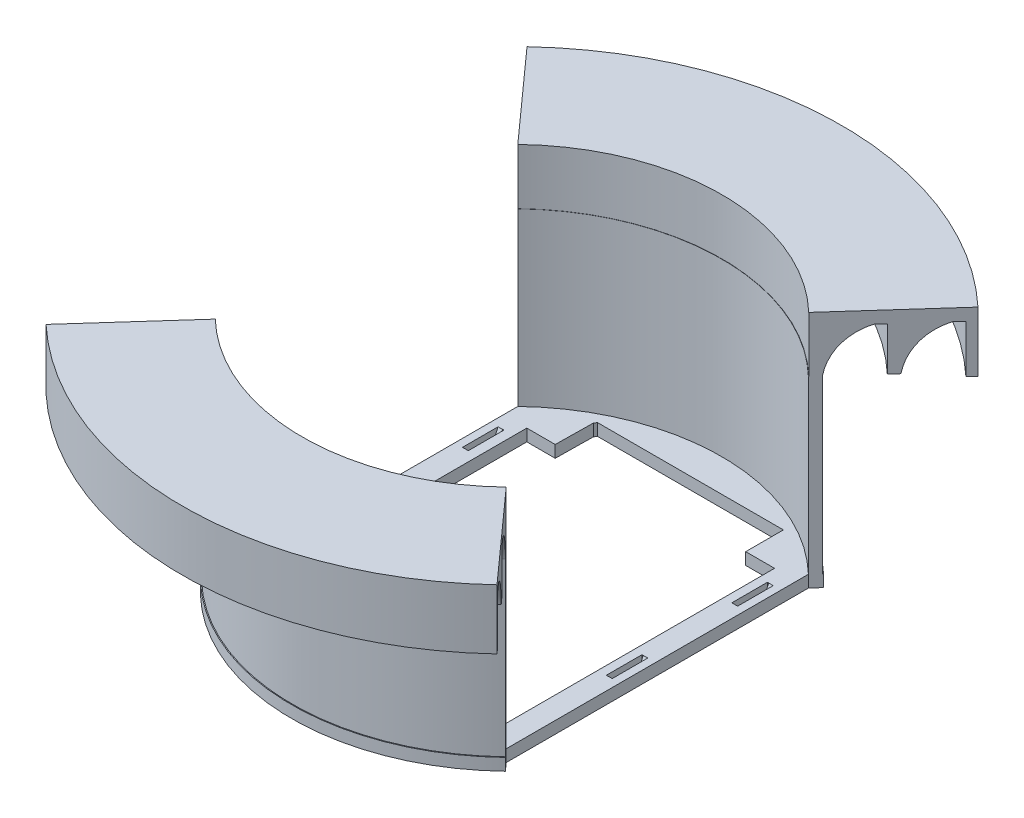
from build123d import *

# Parameters (mm, degrees)
SKETCH1_R                = 51.5
BOSS_EXTRUDE1_DEPTH      = 2.8
SKETCH2_R                = 51.302702975
SKETCH2_R_2              = 49
BOSS_EXTRUDE2_DEPTH      = 40
CUT_EXTRUDE1_DEPTH       = 2.8
SNAP_START               = -32.152970268
SNAP_GROOVE2_DEPTH       = 1.05
SNAP_START_2             = -33.102970268
SNAP_GROOVE2_2_DEPTH     = 0.95
CUT_EXTRUDE9_DEPTH       = 123.425444719
MIRROR10_START           = -32.152970268
MIRROR10_COPY_1_DEPTH    = 1.05
MIRROR10_START_2         = -33.102970268
MIRROR10_COPY_2_DEPTH    = 0.95
MIRROR10_COPY_3_DEPTH    = 0.95
SKETCH23_W               = 0.31
SKETCH23_H               = 8.321250797
CUT_EXTRUDE18_DEPTH      = 10
MIRROR12_COPY_1_SKETCH_W = 0.31
MIRROR12_COPY_1_SKETCH_H = 8.321250797
MIRROR12_COPY_1_DEPTH    = 10


# Read off the part's stored shape, not the designer's step: Snap Groove2
with BuildPart() as part:
    # Sketch1 → Boss-Extrude1 (new body)
    with BuildSketch(Plane(origin=(0, 0, 0), x_dir=(1, 0, 0), z_dir=(0, 1, 0))):
        with Locations(Location((0, 0, 0), (0, 0, 270))):
            Circle(SKETCH1_R)
    extrude(amount=BOSS_EXTRUDE1_DEPTH)

    # Sketch2 → Boss-Extrude2 (add)
    with BuildSketch(Plane(origin=(0, 2.8, 0), x_dir=(1, 0, 0), z_dir=(0, 1, 0))):
        with Locations(Location((0, 0, 0), (0, 0, 270))):
            Circle(SKETCH2_R)
        with Locations(Location((0, 0, 0), (0, 0, 270))):
            Circle(SKETCH2_R_2, mode=Mode.SUBTRACT)
    extrude(amount=BOSS_EXTRUDE2_DEPTH)

    # Sketch3 → Cut-Extrude1 (cut)
    with BuildSketch(Plane(origin=(0, 2.8, 0), x_dir=(1, 0, 0), z_dir=(0, 1, 0))):
        Polygon((28.803377941, 30.903803584), (28.803377941, -35.91647658), (22.504161148, -35.91647658), (22.611913195, -42.365053075), (21.509867104, -43.633319461), (18.751547007, -44.925112233), (17.307649543, -45.070983147), (-17.226935769, -45.070983147), (-18.600923478, -44.925112233), (-21.77353452, -43.416317025), (-21.77353452, -43.046957831), (-21.893563057, -35.863677115), (-28.534712584, -35.863677115), (-28.534712584, 31.993942871), (-21.893563057, 31.993942871), (-21.77353452, 40.794290055), (-21.388795882, 41.368785458), (22.021637567, 41.368785458), (22.058242529, 41.352489898), (22.058242529, 32.561962301), (28.803377941, 32.561962301), align=None)
    extrude(amount=-CUT_EXTRUDE1_DEPTH, mode=Mode.SUBTRACT)

    # Sketch5 → Revolve1 (revolve)
    with BuildSketch(Plane(origin=(0, 0, 0), x_dir=(0, 0, -1), z_dir=(1, 0, 0)), mode=Mode.PRIVATE) as revolve1_sk:
        with BuildLine():
            Line((-51.302702975, 42.8), (-49.053064555, 42.8))
            Line((-49.053064555, 42.8), (-49.053064555, 55.8))
            Line((-49.053064555, 55.8), (-60.053064555, 55.8))
            Line((-60.053064555, 55.8), (-60.053064555, 53.073629834))
            ThreePointArc((-60.053064555, 53.073629834), (-54.22806986, 49.171665315), (-51.302702975, 42.8))
        make_face()
        Polygon((-60.053064555, 53.073629834), (-60.053064555, 55.8), (-62.053064555, 55.8), (-62.053064555, 52.983272883), (-60.053064555, 52.983272883), align=None)
        with BuildLine():
            Line((-62.053064555, 52.983272883), (-62.053064555, 55.8))
            Line((-62.053064555, 55.8), (-73.053064555, 55.8))
            Line((-73.053064555, 55.8), (-73.053064555, 53.073629834))
            ThreePointArc((-73.053064555, 53.073629834), (-67.22806986, 49.171665315), (-64.302702975, 42.8))
            Line((-64.302702975, 42.8), (-62.053064555, 42.8))
            Line((-62.053064555, 42.8), (-62.053064555, 52.983272883))
        make_face()
        Polygon((-73.053064555, 53.073629834), (-73.053064555, 55.8), (-77.053064555, 55.8), (-77.053064555, 41.8), (-75.053064555, 41.8), (-75.053064555, 52.983272883), (-73.053064555, 52.983272883), align=None)
    revolve(revolve1_sk.sketch.rotate(Axis((0, 42.8, 0), (0, 1, 0)), 180), axis=Axis((0, 42.8, 0), (0, 1, 0)))

    # Snap Groove2 outline → Snap Groove2 (cut)
    with BuildSketch(Plane.YZ.offset(SNAP_START)):
        Polygon((0, 7.425343804), (0, 1.722535804), (2.8, 0.416874361), (2.8, 8.731005247), align=None)
    snap_groove2 = extrude(amount=SNAP_GROOVE2_DEPTH, mode=Mode.SUBTRACT)

    # Snap Groove2 2 outline → Snap Groove2 2 (cut)
    with BuildSketch(Plane.YZ.offset(SNAP_START_2)):
        Polygon((0, 7.425343804), (0, 1.722535804), (0.54641169, 1.467739849), (0.54641169, 7.68013976), align=None)
    snap_groove2_2 = extrude(amount=SNAP_GROOVE2_2_DEPTH, mode=Mode.SUBTRACT)

    # Sketch13 → Cut-Extrude9 (cut, symmetric)
    with BuildSketch(Plane(origin=(0, 55.8, 0), x_dir=(1, 0, 0), z_dir=(0, 1, 0))):
        Polygon((-92.348219575, -56.21042489), (-92.348219575, 56.21042489), (-52.702589035, 56.21042489), (-33.965663886, 35.317611426), (-33.965663886, -35.317611426), (-52.702589035, -56.21042489), align=None)
    cut_extrude9 = extrude(amount=CUT_EXTRUDE9_DEPTH, both=True, mode=Mode.SUBTRACT)

    # Mirror7: Cut-Extrude9 across plane
    add(cut_extrude9.mirror(Plane(origin=(0, 0, 0), x_dir=(0, 0, 1), z_dir=(1, 0, 0))), mode=Mode.SUBTRACT)

    # Mirror9: Snap Groove2, Snap Groove2 2 across plane
    add(snap_groove2.mirror(Plane(origin=(0, 0, 0), x_dir=(0, 0, 1), z_dir=(1, 0, 0))), mode=Mode.SUBTRACT)
    add(snap_groove2_2.mirror(Plane(origin=(0, 0, 0), x_dir=(0, 0, 1), z_dir=(1, 0, 0))), mode=Mode.SUBTRACT)

    # Mirror10: Snap Groove2, Snap Groove2 2 across plane
    add(snap_groove2.mirror(Plane(origin=(0.02272558, 10.52276449, -10.082239745), x_dir=(1, 0, 0), z_dir=(0, 0, -1))), mode=Mode.SUBTRACT)
    add(snap_groove2_2.mirror(Plane(origin=(0.02272558, 10.52276449, -10.082239745), x_dir=(1, 0, 0), z_dir=(0, 0, -1))), mode=Mode.SUBTRACT)

    # Mirror10 copy 1 sketch → Mirror10 copy 1 (cut)
    with BuildSketch(Plane(origin=(0, 0, -20.164479489), x_dir=(0, 1, 0), z_dir=(-1, 0, 0)).offset(MIRROR10_START)):
        Polygon((0, 7.425343804), (0, 1.722535804), (2.8, 0.416874361), (2.8, 8.731005247), align=None)
    extrude(amount=MIRROR10_COPY_1_DEPTH, mode=Mode.SUBTRACT)

    # Mirror10 copy 2 sketch → Mirror10 copy 2 (cut)
    with BuildSketch(Plane(origin=(0, 0, -20.164479489), x_dir=(0, 1, 0), z_dir=(-1, 0, 0)).offset(MIRROR10_START_2)):
        Polygon((0, 7.425343804), (0, 1.722535804), (0.54641169, 1.467739849), (0.54641169, 7.68013976), align=None)
    extrude(amount=MIRROR10_COPY_2_DEPTH, mode=Mode.SUBTRACT)

    # Mirror10 copy 3 sketch → Mirror10 copy 3 (cut)
    with BuildSketch(Plane(origin=(0, 0, -20.164479489), x_dir=(0, 1, 0), z_dir=(1, 0, 0)).offset(MIRROR10_START_2)):
        Polygon((0, -7.425343804), (0, -1.722535804), (0.54641169, -1.467739849), (0.54641169, -7.68013976), align=None)
    extrude(amount=MIRROR10_COPY_3_DEPTH, mode=Mode.SUBTRACT)

    # Sketch23 → Cut-Extrude18 (cut)
    with BuildSketch(Plane(origin=(0, 2.8, 0), x_dir=(1, 0, 0), z_dir=(0, 1, 0))):
        with Locations((30.947970268, 24.74197925)):
            Rectangle(SKETCH23_W, SKETCH23_H)
    cut_extrude18 = extrude(amount=-CUT_EXTRUDE18_DEPTH, mode=Mode.SUBTRACT)

    # Mirror11: Cut-Extrude18 across plane
    add(cut_extrude18.mirror(Plane(origin=(0, 0, 0), x_dir=(0, 0, 1), z_dir=(1, 0, 0))), mode=Mode.SUBTRACT)

    # Mirror12: Cut-Extrude18 across plane
    add(cut_extrude18.mirror(Plane(origin=(0.02272558, 10.52276449, -10.082239745), x_dir=(1, 0, 0), z_dir=(0, 0, -1))), mode=Mode.SUBTRACT)

    # Mirror12 copy 1 sketch → Mirror12 copy 1 (cut)
    with BuildSketch(Plane(origin=(0, 2.8, -20.164479489), x_dir=(-1, 0, 0), z_dir=(0, 1, 0))):
        with Locations((30.947970268, 24.74197925)):
            Rectangle(MIRROR12_COPY_1_SKETCH_W, MIRROR12_COPY_1_SKETCH_H)
    extrude(amount=-MIRROR12_COPY_1_DEPTH, mode=Mode.SUBTRACT)


solid = part.part
